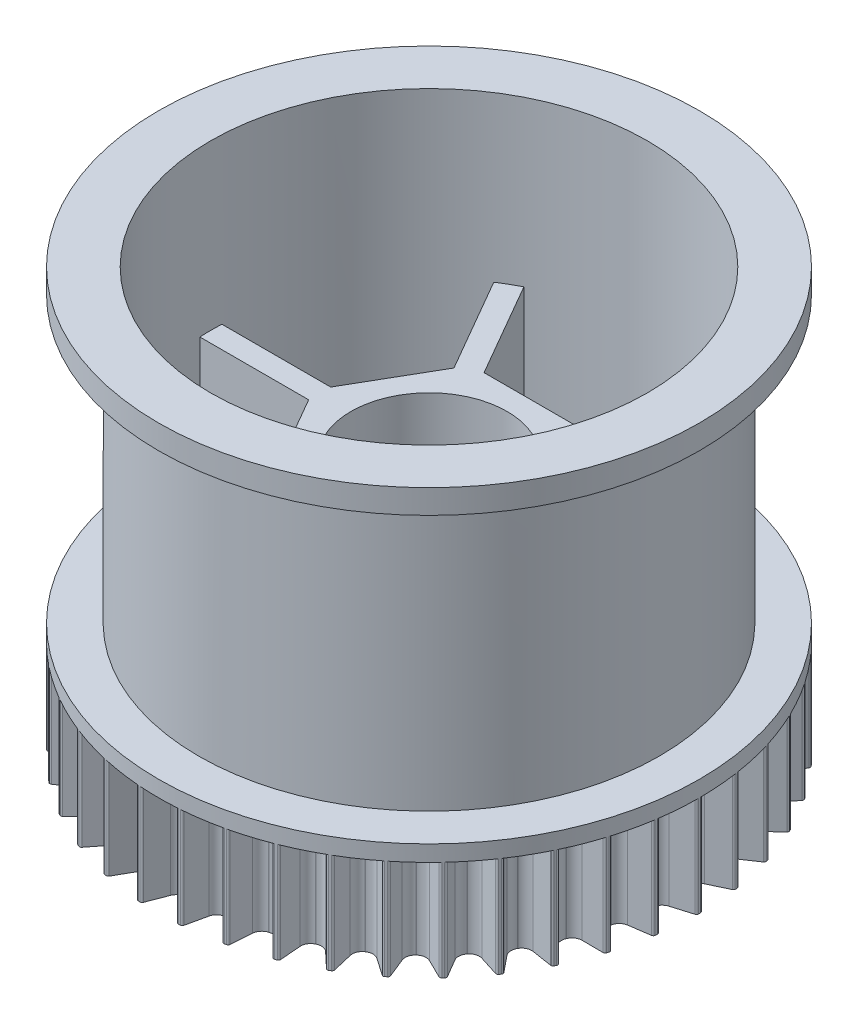
from build123d import *

# Parameters (mm, degrees)
SKETCH_1_R          = 3.9
EXTRUDE_1_DEPTH     = 5
SKETCH_2_R          = 13.5
SKETCH_2_R_2        = 11.2
EXTRUDE_2_DEPTH     = 0.8
SKETCH_2_2_R        = 11.5
SKETCH_2_2_R_2      = 10.9
EXTRUDE_2_2_DEPTH   = 15
SKETCH_5_R          = 13.5
SKETCH_5_R_2        = 10.9
EXTRUDE_3_DEPTH     = 1.2
SKETCH_6_R          = 3.9
EXTRUDE_5_DEPTH     = 8
SKETCH_8_R          = 3.9
SKETCH_8_R_2        = 3.4
EXTRUDE_6_DEPTH     = 13
SKETCH_8_2_R        = 3.9
SKETCH_8_2_R_2      = 3.4
CUT_EXTRUDE_1_DEPTH = 3
CUT_EXTRUDE_START   = -3
SKETCH_9_R          = 3.9
CUT_EXTRUDE_2_DEPTH = 3


with BuildPart() as part:
    # 草图1 → 凸台-拉伸1 (new body)
    with BuildSketch(Plane(origin=(0, 0, 0), x_dir=(1, 0, 0), z_dir=(0, 1, 0))):
        with BuildLine():
            Line((12.421648835, 0.449416948), (13.428727986, 0.146279171))
            ThreePointArc((13.428727986, 0.146279171), (13.480048996, 0.110330314), (13.499904043, 0.050900158))
            ThreePointArc((13.499904043, 0.050900158), (13.5, 0), (13.499904043, -0.050900158))
            ThreePointArc((13.499904043, -0.050900158), (13.480048996, -0.110330314), (13.428727986, -0.146279171))
            Line((13.428727986, -0.146279171), (12.421648835, -0.449416948))
            ThreePointArc((12.421648835, -0.449416948), (12.175747513, -0.615329239), (12.067123529, -0.89136398))
            ThreePointArc((12.067123529, -0.89136398), (12.066165946, -0.904234132), (12.065194637, -0.917103256))
            ThreePointArc((12.065194637, -0.917103256), (12.131464538, -1.206244482), (12.349891401, -1.40695336))
            Line((12.349891401, -1.40695336), (13.300541969, -1.856802698))
            ThreePointArc((13.300541969, -1.856802698), (13.345931866, -1.899999035), (13.356707544, -1.961724646))
            ThreePointArc((13.356707544, -1.961724646), (13.349216154, -2.012070593), (13.341534994, -2.062387937))
            ThreePointArc((13.341534994, -2.062387937), (13.313044106, -2.118195066), (13.256938411, -2.146093404))
            Line((13.256938411, -2.146093404), (12.21592716, -2.295748024))
            ThreePointArc((12.21592716, -2.295748024), (11.948044409, -2.423157522), (11.799492821, -2.679919618))
            ThreePointArc((11.799492821, -2.679919618), (11.796627737, -2.692503301), (11.793749233, -2.705083921))
            ThreePointArc((11.793749233, -2.705083921), (11.816184691, -3.000872694), (12.0022578, -3.231894655))
            Line((12.0022578, -3.231894655), (12.875243823, -3.818406662))
            ThreePointArc((12.875243823, -3.818406662), (12.913688672, -3.867885545), (12.915144269, -3.930527764))
            ThreePointArc((12.915144269, -3.930527764), (12.900232878, -3.979194855), (12.885138099, -4.027805378))
            ThreePointArc((12.885138099, -4.027805378), (12.84864781, -4.07874284), (12.789010738, -4.097967457))
            Line((12.789010738, -4.097967457), (11.737321858, -4.090795883))
            ThreePointArc((11.737321858, -4.090795883), (11.453441736, -4.176856469), (11.268280943, -4.40861028))
            ThreePointArc((11.268280943, -4.40861028), (11.263572359, -4.420626395), (11.258850961, -4.432637481))
            ThreePointArc((11.258850961, -4.432637481), (11.236950804, -4.72846637), (11.386513594, -4.984640763))
            Line((11.386513594, -4.984640763), (12.162334005, -5.694713732))
            ThreePointArc((12.162334005, -5.694713732), (12.192975012, -5.749369884), (12.185078013, -5.811529386))
            ThreePointArc((12.185078013, -5.811529386), (12.163079717, -5.857430478), (12.140908512, -5.903248302))
            ThreePointArc((12.140908512, -5.903248302), (12.097233954, -5.94817824), (12.035397698, -5.958299689))
            Line((12.035397698, -5.958299689), (10.996524182, -5.794462121))
            ThreePointArc((10.996524182, -5.794462121), (10.702988102, -5.837251346), (10.485354288, -6.038819873))
            ThreePointArc((10.485354288, -6.038819873), (10.478907386, -6.05), (10.472448563, -6.061173244))
            ThreePointArc((10.472448563, -6.061173244), (10.406702004, -6.35043392), (10.51641349, -6.626038234))
            Line((10.51641349, -6.626038234), (11.177737743, -7.443810306))
            ThreePointArc((11.177737743, -7.443810306), (11.199890439, -7.5024228), (11.18281725, -7.562711045))
            ThreePointArc((11.18281725, -7.562711045), (11.154223453, -7.604820784), (11.12547109, -7.646822414))
            ThreePointArc((11.12547109, -7.646822414), (11.075587881, -7.684741166), (11.012933761, -7.685533352))
            Line((11.012933761, -7.685533352), (10.010082327, -7.368689651))
            ThreePointArc((10.010082327, -7.368689651), (9.713447399, -7.367251672), (9.468202145, -7.534132209))
            ThreePointArc((9.468202145, -7.534132209), (9.460160938, -7.544226602), (9.452108969, -7.554312413))
            ThreePointArc((9.452108969, -7.554312413), (9.343984679, -7.83054327), (9.411394086, -8.11942096))
            Line((9.411394086, -8.11942096), (9.943449291, -9.026624459))
            ThreePointArc((9.943449291, -9.026624459), (9.956618821, -9.087883988), (9.930750828, -9.144954237))
            ThreePointArc((9.930750828, -9.144954237), (9.89620027, -9.18233196), (9.861509029, -9.219579149))
            ThreePointArc((9.861509029, -9.219579149), (9.806531477, -9.249639674), (9.744459083, -9.241084899))
            Line((9.744459083, -9.241084899), (8.800031773, -8.778312831))
            ThreePointArc((8.800031773, -8.778312831), (8.506924332, -8.732679771), (8.239546012, -8.861144482))
            ThreePointArc((8.239546012, -8.861144482), (8.230090127, -8.869927649), (8.22062488, -8.878700726))
            ThreePointArc((8.22062488, -8.878700726), (8.072538176, -9.135731223), (8.09613969, -9.431429239))
            Line((8.09613969, -9.431429239), (8.487040612, -10.407798738))
            ThreePointArc((8.487040612, -10.407798738), (8.49093279, -10.470336865), (8.456847843, -10.522914262))
            ThreePointArc((8.456847843, -10.522914262), (8.417112325, -10.554725013), (8.377257151, -10.586385721))
            ThreePointArc((8.377257151, -10.586385721), (8.318413365, -10.607916516), (8.258309291, -10.59020588))
            Line((8.258309291, -10.59020588), (7.393403052, -9.991843007))
            ThreePointArc((7.393403052, -9.991843007), (7.110370633, -9.903034234), (6.826832036, -9.990213429))
            ThreePointArc((6.826832036, -9.990213429), (6.816172703, -9.997489169), (6.805505615, -10.004753536))
            ThreePointArc((6.805505615, -10.004753536), (6.620764509, -10.236842037), (6.600030911, -10.532754974))
            Line((6.600030911, -10.532754974), (6.841045471, -11.556479991))
            ThreePointArc((6.841045471, -11.556479991), (6.835573353, -11.618899718), (6.794032851, -11.665809771))
            ThreePointArc((6.794032851, -11.665809771), (6.75, -11.691342951), (6.705871192, -11.716709929))
            ThreePointArc((6.705871192, -11.716709929), (6.644475643, -11.729230032), (6.587682515, -11.702759162))
            Line((6.587682515, -11.702759162), (5.821617923, -10.982171922))
            ThreePointArc((5.821617923, -10.982171922), (5.554983004, -10.852171276), (5.261617913, -10.896117516))
            ThreePointArc((5.261617913, -10.896117516), (5.249993243, -10.901723302), (5.238362601, -10.907316685))
            ThreePointArc((5.238362601, -10.907316685), (5.021093904, -11.109278715), (4.956488349, -11.398796367))
            Line((4.956488349, -11.398796367), (5.042232678, -12.447008578))
            ThreePointArc((5.042232678, -12.447008578), (5.027518502, -12.507915551), (4.979450393, -12.548110367))
            ThreePointArc((4.979450393, -12.548110367), (4.932103829, -12.566795607), (4.884687151, -12.585302199))
            ThreePointArc((4.884687151, -12.585302199), (4.822111316, -12.588531931), (4.769897799, -12.553892142))
            Line((4.769897799, -12.553892142), (4.11978747, -11.727177263))
            ThreePointArc((4.11978747, -11.727177263), (3.875506233, -11.558888745), (3.578867941, -11.558620344))
            ThreePointArc((3.578867941, -11.558620344), (3.56653761, -11.56243095), (3.554203222, -11.566228402))
            ThreePointArc((3.554203222, -11.566228402), (3.309260359, -11.733552465), (3.202226027, -12.010207485))
            Line((3.202226027, -12.010207485), (3.13078474, -13.059491561))
            ThreePointArc((3.13078474, -13.059491561), (3.107157195, -13.117525219), (3.053635241, -13.150106913))
            ThreePointArc((3.053635241, -13.150106913), (3.004032608, -13.161526814), (2.954387271, -13.172759614))
            ThreePointArc((2.954387271, -13.172759614), (2.89202899, -13.166626828), (2.845561447, -13.124591917))
            Line((2.845561447, -13.124591917), (2.325927773, -12.210216843))
            ThreePointArc((2.325927773, -12.210216843), (2.109457058, -12.007399739), (1.816171974, -11.962922693))
            ThreePointArc((1.816171974, -11.962922693), (1.803411421, -11.964852997), (1.790648816, -11.96676969))
            ThreePointArc((1.790648816, -11.96676969), (1.523503405, -12.095718042), (1.376431267, -12.353330415))
            Line((1.376431267, -12.353330415), (1.149400244, -13.380247083))
            ThreePointArc((1.149400244, -13.380247083), (1.117387131, -13.43411105), (1.059606923, -13.4583518))
            ThreePointArc((1.059606923, -13.4583518), (1.008856263, -13.462251262), (0.958091262, -13.465959347))
            ThreePointArc((0.958091262, -13.465959347), (0.897343515, -13.45060104), (0.857659955, -13.402109995))
            Line((0.857659955, -13.402109995), (0.480110693, -12.420500356))
            ThreePointArc((0.480110693, -12.420500356), (0.296286097, -12.187685265), (0.012905725, -12.099993117))
            ThreePointArc((0.012905725, -12.099993117), (0, -12.1), (-0.012905725, -12.099993117))
            ThreePointArc((-0.012905725, -12.099993117), (-0.296286097, -12.187685265), (-0.480110693, -12.420500356))
            Line((-0.480110693, -12.420500356), (-0.857659955, -13.402109995))
            ThreePointArc((-0.857659955, -13.402109995), (-0.897343515, -13.45060104), (-0.958091262, -13.465959347))
            ThreePointArc((-0.958091262, -13.465959347), (-1.008856263, -13.462251262), (-1.059606923, -13.4583518))
            ThreePointArc((-1.059606923, -13.4583518), (-1.117387131, -13.43411105), (-1.149400244, -13.380247083))
            Line((-1.149400244, -13.380247083), (-1.376431267, -12.353330415))
            ThreePointArc((-1.376431267, -12.353330415), (-1.523503405, -12.095718042), (-1.790648816, -11.96676969))
            ThreePointArc((-1.790648816, -11.96676969), (-1.803411421, -11.964852997), (-1.816171974, -11.962922693))
            ThreePointArc((-1.816171974, -11.962922693), (-2.109457058, -12.007399739), (-2.325927773, -12.210216843))
            Line((-2.325927773, -12.210216843), (-2.845561447, -13.124591917))
            ThreePointArc((-2.845561447, -13.124591917), (-2.89202899, -13.166626828), (-2.954387271, -13.172759614))
            ThreePointArc((-2.954387271, -13.172759614), (-3.004032608, -13.161526814), (-3.053635241, -13.150106913))
            ThreePointArc((-3.053635241, -13.150106913), (-3.107157195, -13.117525219), (-3.13078474, -13.059491561))
            Line((-3.13078474, -13.059491561), (-3.202226027, -12.010207485))
            ThreePointArc((-3.202226027, -12.010207485), (-3.309260359, -11.733552465), (-3.554203222, -11.566228402))
            ThreePointArc((-3.554203222, -11.566228402), (-3.56653761, -11.56243095), (-3.578867941, -11.558620344))
            ThreePointArc((-3.578867941, -11.558620344), (-3.875506233, -11.558888745), (-4.11978747, -11.727177263))
            Line((-4.11978747, -11.727177263), (-4.769897799, -12.553892142))
            ThreePointArc((-4.769897799, -12.553892142), (-4.822111316, -12.588531931), (-4.884687151, -12.585302199))
            ThreePointArc((-4.884687151, -12.585302199), (-4.932103829, -12.566795607), (-4.979450393, -12.548110367))
            ThreePointArc((-4.979450393, -12.548110367), (-5.027518502, -12.507915551), (-5.042232678, -12.447008578))
            Line((-5.042232678, -12.447008578), (-4.956488349, -11.398796367))
            ThreePointArc((-4.956488349, -11.398796367), (-5.021093904, -11.109278715), (-5.238362601, -10.907316685))
            ThreePointArc((-5.238362601, -10.907316685), (-5.249993243, -10.901723302), (-5.261617913, -10.896117516))
            ThreePointArc((-5.261617913, -10.896117516), (-5.554983004, -10.852171276), (-5.821617923, -10.982171922))
            Line((-5.821617923, -10.982171922), (-6.587682515, -11.702759162))
            ThreePointArc((-6.587682515, -11.702759162), (-6.644475643, -11.729230032), (-6.705871192, -11.716709929))
            ThreePointArc((-6.705871192, -11.716709929), (-6.75, -11.691342951), (-6.794032851, -11.665809771))
            ThreePointArc((-6.794032851, -11.665809771), (-6.835573353, -11.618899718), (-6.841045471, -11.556479991))
            Line((-6.841045471, -11.556479991), (-6.600030911, -10.532754974))
            ThreePointArc((-6.600030911, -10.532754974), (-6.620764509, -10.236842037), (-6.805505615, -10.004753536))
            ThreePointArc((-6.805505615, -10.004753536), (-6.816172703, -9.997489169), (-6.826832036, -9.990213429))
            ThreePointArc((-6.826832036, -9.990213429), (-7.110370633, -9.903034234), (-7.393403052, -9.991843007))
            Line((-7.393403052, -9.991843007), (-8.258309291, -10.59020588))
            ThreePointArc((-8.258309291, -10.59020588), (-8.318413365, -10.607916516), (-8.377257151, -10.586385721))
            ThreePointArc((-8.377257151, -10.586385721), (-8.417112325, -10.554725013), (-8.456847843, -10.522914262))
            ThreePointArc((-8.456847843, -10.522914262), (-8.49093279, -10.470336865), (-8.487040612, -10.407798738))
            Line((-8.487040612, -10.407798738), (-8.09613969, -9.431429239))
            ThreePointArc((-8.09613969, -9.431429239), (-8.072538176, -9.135731223), (-8.22062488, -8.878700726))
            ThreePointArc((-8.22062488, -8.878700726), (-8.230090127, -8.869927649), (-8.239546012, -8.861144482))
            ThreePointArc((-8.239546012, -8.861144482), (-8.506924332, -8.732679771), (-8.800031773, -8.778312831))
            Line((-8.800031773, -8.778312831), (-9.744459083, -9.241084899))
            ThreePointArc((-9.744459083, -9.241084899), (-9.806531477, -9.249639674), (-9.861509029, -9.219579149))
            ThreePointArc((-9.861509029, -9.219579149), (-9.89620027, -9.18233196), (-9.930750828, -9.144954237))
            ThreePointArc((-9.930750828, -9.144954237), (-9.956618821, -9.087883988), (-9.943449291, -9.026624459))
            Line((-9.943449291, -9.026624459), (-9.411394086, -8.11942096))
            ThreePointArc((-9.411394086, -8.11942096), (-9.343984679, -7.83054327), (-9.452108969, -7.554312413))
            ThreePointArc((-9.452108969, -7.554312413), (-9.460160938, -7.544226602), (-9.468202145, -7.534132209))
            ThreePointArc((-9.468202145, -7.534132209), (-9.713447399, -7.367251672), (-10.010082327, -7.368689651))
            Line((-10.010082327, -7.368689651), (-11.012933761, -7.685533352))
            ThreePointArc((-11.012933761, -7.685533352), (-11.075587881, -7.684741166), (-11.12547109, -7.646822414))
            ThreePointArc((-11.12547109, -7.646822414), (-11.154223453, -7.604820784), (-11.18281725, -7.562711045))
            ThreePointArc((-11.18281725, -7.562711045), (-11.199890439, -7.5024228), (-11.177737743, -7.443810306))
            Line((-11.177737743, -7.443810306), (-10.51641349, -6.626038234))
            ThreePointArc((-10.51641349, -6.626038234), (-10.406702004, -6.35043392), (-10.472448563, -6.061173244))
            ThreePointArc((-10.472448563, -6.061173244), (-10.478907386, -6.05), (-10.485354288, -6.038819873))
            ThreePointArc((-10.485354288, -6.038819873), (-10.702988102, -5.837251346), (-10.996524182, -5.794462121))
            Line((-10.996524182, -5.794462121), (-12.035397698, -5.958299689))
            ThreePointArc((-12.035397698, -5.958299689), (-12.097233954, -5.94817824), (-12.140908512, -5.903248302))
            ThreePointArc((-12.140908512, -5.903248302), (-12.163079717, -5.857430478), (-12.185078013, -5.811529386))
            ThreePointArc((-12.185078013, -5.811529386), (-12.192975012, -5.749369884), (-12.162334005, -5.694713732))
            Line((-12.162334005, -5.694713732), (-11.386513594, -4.984640763))
            ThreePointArc((-11.386513594, -4.984640763), (-11.236950804, -4.72846637), (-11.258850961, -4.432637481))
            ThreePointArc((-11.258850961, -4.432637481), (-11.263572359, -4.420626395), (-11.268280943, -4.40861028))
            ThreePointArc((-11.268280943, -4.40861028), (-11.453441736, -4.176856469), (-11.737321858, -4.090795883))
            Line((-11.737321858, -4.090795883), (-12.789010738, -4.097967457))
            ThreePointArc((-12.789010738, -4.097967457), (-12.84864781, -4.07874284), (-12.885138099, -4.027805378))
            ThreePointArc((-12.885138099, -4.027805378), (-12.900232878, -3.979194855), (-12.915144269, -3.930527764))
            ThreePointArc((-12.915144269, -3.930527764), (-12.913688672, -3.867885545), (-12.875243823, -3.818406662))
            Line((-12.875243823, -3.818406662), (-12.0022578, -3.231894655))
            ThreePointArc((-12.0022578, -3.231894655), (-11.816184691, -3.000872694), (-11.793749233, -2.705083921))
            ThreePointArc((-11.793749233, -2.705083921), (-11.796627737, -2.692503301), (-11.799492821, -2.679919618))
            ThreePointArc((-11.799492821, -2.679919618), (-11.948044409, -2.423157522), (-12.21592716, -2.295748024))
            Line((-12.21592716, -2.295748024), (-13.256938411, -2.146093404))
            ThreePointArc((-13.256938411, -2.146093404), (-13.313044106, -2.118195066), (-13.341534994, -2.062387937))
            ThreePointArc((-13.341534994, -2.062387937), (-13.349216154, -2.012070593), (-13.356707544, -1.961724646))
            ThreePointArc((-13.356707544, -1.961724646), (-13.345931866, -1.899999035), (-13.300541969, -1.856802698))
            Line((-13.300541969, -1.856802698), (-12.349891401, -1.40695336))
            ThreePointArc((-12.349891401, -1.40695336), (-12.131464538, -1.206244482), (-12.065194637, -0.917103256))
            ThreePointArc((-12.065194637, -0.917103256), (-12.066165946, -0.904234132), (-12.067123529, -0.89136398))
            ThreePointArc((-12.067123529, -0.89136398), (-12.175747513, -0.615329239), (-12.421648835, -0.449416948))
            Line((-12.421648835, -0.449416948), (-13.428727986, -0.146279171))
            ThreePointArc((-13.428727986, -0.146279171), (-13.480048996, -0.110330314), (-13.499904043, -0.050900158))
            ThreePointArc((-13.499904043, -0.050900158), (-13.5, 0), (-13.499904043, 0.050900158))
            ThreePointArc((-13.499904043, 0.050900158), (-13.480048996, 0.110330314), (-13.428727986, 0.146279171))
            Line((-13.428727986, 0.146279171), (-12.421648835, 0.449416948))
            ThreePointArc((-12.421648835, 0.449416948), (-12.175747513, 0.615329239), (-12.067123529, 0.89136398))
            ThreePointArc((-12.067123529, 0.89136398), (-12.066165946, 0.904234132), (-12.065194637, 0.917103256))
            ThreePointArc((-12.065194637, 0.917103256), (-12.131464538, 1.206244482), (-12.349891401, 1.40695336))
            Line((-12.349891401, 1.40695336), (-13.300541969, 1.856802698))
            ThreePointArc((-13.300541969, 1.856802698), (-13.345931866, 1.899999035), (-13.356707544, 1.961724646))
            ThreePointArc((-13.356707544, 1.961724646), (-13.349216154, 2.012070593), (-13.341534994, 2.062387937))
            ThreePointArc((-13.341534994, 2.062387937), (-13.313044106, 2.118195066), (-13.256938411, 2.146093404))
            Line((-13.256938411, 2.146093404), (-12.21592716, 2.295748024))
            ThreePointArc((-12.21592716, 2.295748024), (-11.948044409, 2.423157522), (-11.799492821, 2.679919618))
            ThreePointArc((-11.799492821, 2.679919618), (-11.796627737, 2.692503301), (-11.793749233, 2.705083921))
            ThreePointArc((-11.793749233, 2.705083921), (-11.816184691, 3.000872694), (-12.0022578, 3.231894655))
            Line((-12.0022578, 3.231894655), (-12.875243823, 3.818406662))
            ThreePointArc((-12.875243823, 3.818406662), (-12.913688672, 3.867885545), (-12.915144269, 3.930527764))
            ThreePointArc((-12.915144269, 3.930527764), (-12.900232878, 3.979194855), (-12.885138099, 4.027805378))
            ThreePointArc((-12.885138099, 4.027805378), (-12.84864781, 4.07874284), (-12.789010738, 4.097967457))
            Line((-12.789010738, 4.097967457), (-11.737321858, 4.090795883))
            ThreePointArc((-11.737321858, 4.090795883), (-11.453441736, 4.176856469), (-11.268280943, 4.40861028))
            ThreePointArc((-11.268280943, 4.40861028), (-11.263572359, 4.420626395), (-11.258850961, 4.432637481))
            ThreePointArc((-11.258850961, 4.432637481), (-11.236950804, 4.72846637), (-11.386513594, 4.984640763))
            Line((-11.386513594, 4.984640763), (-12.162334005, 5.694713732))
            ThreePointArc((-12.162334005, 5.694713732), (-12.192975012, 5.749369884), (-12.185078013, 5.811529386))
            ThreePointArc((-12.185078013, 5.811529386), (-12.163079717, 5.857430478), (-12.140908512, 5.903248302))
            ThreePointArc((-12.140908512, 5.903248302), (-12.097233954, 5.94817824), (-12.035397698, 5.958299689))
            Line((-12.035397698, 5.958299689), (-10.996524182, 5.794462121))
            ThreePointArc((-10.996524182, 5.794462121), (-10.702988102, 5.837251346), (-10.485354288, 6.038819873))
            ThreePointArc((-10.485354288, 6.038819873), (-10.478907386, 6.05), (-10.472448563, 6.061173244))
            ThreePointArc((-10.472448563, 6.061173244), (-10.406702004, 6.35043392), (-10.51641349, 6.626038234))
            Line((-10.51641349, 6.626038234), (-11.177737743, 7.443810306))
            ThreePointArc((-11.177737743, 7.443810306), (-11.199890439, 7.5024228), (-11.18281725, 7.562711045))
            ThreePointArc((-11.18281725, 7.562711045), (-11.154223453, 7.604820784), (-11.12547109, 7.646822414))
            ThreePointArc((-11.12547109, 7.646822414), (-11.075587881, 7.684741166), (-11.012933761, 7.685533352))
            Line((-11.012933761, 7.685533352), (-10.010082327, 7.368689651))
            ThreePointArc((-10.010082327, 7.368689651), (-9.713447399, 7.367251672), (-9.468202145, 7.534132209))
            ThreePointArc((-9.468202145, 7.534132209), (-9.460160938, 7.544226602), (-9.452108969, 7.554312413))
            ThreePointArc((-9.452108969, 7.554312413), (-9.343984679, 7.83054327), (-9.411394086, 8.11942096))
            Line((-9.411394086, 8.11942096), (-9.943449291, 9.026624459))
            ThreePointArc((-9.943449291, 9.026624459), (-9.956618821, 9.087883988), (-9.930750828, 9.144954237))
            ThreePointArc((-9.930750828, 9.144954237), (-9.89620027, 9.18233196), (-9.861509029, 9.219579149))
            ThreePointArc((-9.861509029, 9.219579149), (-9.806531477, 9.249639674), (-9.744459083, 9.241084899))
            Line((-9.744459083, 9.241084899), (-8.800031773, 8.778312831))
            ThreePointArc((-8.800031773, 8.778312831), (-8.506924332, 8.732679771), (-8.239546012, 8.861144482))
            ThreePointArc((-8.239546012, 8.861144482), (-8.230090127, 8.869927649), (-8.22062488, 8.878700726))
            ThreePointArc((-8.22062488, 8.878700726), (-8.072538176, 9.135731223), (-8.09613969, 9.431429239))
            Line((-8.09613969, 9.431429239), (-8.487040612, 10.407798738))
            ThreePointArc((-8.487040612, 10.407798738), (-8.49093279, 10.470336865), (-8.456847843, 10.522914262))
            ThreePointArc((-8.456847843, 10.522914262), (-8.417112325, 10.554725013), (-8.377257151, 10.586385721))
            ThreePointArc((-8.377257151, 10.586385721), (-8.318413365, 10.607916516), (-8.258309291, 10.59020588))
            Line((-8.258309291, 10.59020588), (-7.393403052, 9.991843007))
            ThreePointArc((-7.393403052, 9.991843007), (-7.110370633, 9.903034234), (-6.826832036, 9.990213429))
            ThreePointArc((-6.826832036, 9.990213429), (-6.816172703, 9.997489169), (-6.805505615, 10.004753536))
            ThreePointArc((-6.805505615, 10.004753536), (-6.620764509, 10.236842037), (-6.600030911, 10.532754974))
            Line((-6.600030911, 10.532754974), (-6.841045471, 11.556479991))
            ThreePointArc((-6.841045471, 11.556479991), (-6.835573353, 11.618899718), (-6.794032851, 11.665809771))
            ThreePointArc((-6.794032851, 11.665809771), (-6.75, 11.691342951), (-6.705871192, 11.716709929))
            ThreePointArc((-6.705871192, 11.716709929), (-6.644475643, 11.729230032), (-6.587682515, 11.702759162))
            Line((-6.587682515, 11.702759162), (-5.821617923, 10.982171922))
            ThreePointArc((-5.821617923, 10.982171922), (-5.554983004, 10.852171276), (-5.261617913, 10.896117516))
            ThreePointArc((-5.261617913, 10.896117516), (-5.249993243, 10.901723302), (-5.238362601, 10.907316685))
            ThreePointArc((-5.238362601, 10.907316685), (-5.021093904, 11.109278715), (-4.956488349, 11.398796367))
            Line((-4.956488349, 11.398796367), (-5.042232678, 12.447008578))
            ThreePointArc((-5.042232678, 12.447008578), (-5.027518502, 12.507915551), (-4.979450393, 12.548110367))
            ThreePointArc((-4.979450393, 12.548110367), (-4.932103829, 12.566795607), (-4.884687151, 12.585302199))
            ThreePointArc((-4.884687151, 12.585302199), (-4.822111316, 12.588531931), (-4.769897799, 12.553892142))
            Line((-4.769897799, 12.553892142), (-4.11978747, 11.727177263))
            ThreePointArc((-4.11978747, 11.727177263), (-3.875506233, 11.558888745), (-3.578867941, 11.558620344))
            ThreePointArc((-3.578867941, 11.558620344), (-3.56653761, 11.56243095), (-3.554203222, 11.566228402))
            ThreePointArc((-3.554203222, 11.566228402), (-3.309260359, 11.733552465), (-3.202226027, 12.010207485))
            Line((-3.202226027, 12.010207485), (-3.13078474, 13.059491561))
            ThreePointArc((-3.13078474, 13.059491561), (-3.107157195, 13.117525219), (-3.053635241, 13.150106913))
            ThreePointArc((-3.053635241, 13.150106913), (-3.004032608, 13.161526814), (-2.954387271, 13.172759614))
            ThreePointArc((-2.954387271, 13.172759614), (-2.89202899, 13.166626828), (-2.845561447, 13.124591917))
            Line((-2.845561447, 13.124591917), (-2.325927773, 12.210216843))
            ThreePointArc((-2.325927773, 12.210216843), (-2.109457058, 12.007399739), (-1.816171974, 11.962922693))
            ThreePointArc((-1.816171974, 11.962922693), (-1.803411421, 11.964852997), (-1.790648816, 11.96676969))
            ThreePointArc((-1.790648816, 11.96676969), (-1.523503405, 12.095718042), (-1.376431267, 12.353330415))
            Line((-1.376431267, 12.353330415), (-1.149400244, 13.380247083))
            ThreePointArc((-1.149400244, 13.380247083), (-1.117387131, 13.43411105), (-1.059606923, 13.4583518))
            ThreePointArc((-1.059606923, 13.4583518), (-1.008856263, 13.462251262), (-0.958091262, 13.465959347))
            ThreePointArc((-0.958091262, 13.465959347), (-0.897343515, 13.45060104), (-0.857659955, 13.402109995))
            Line((-0.857659955, 13.402109995), (-0.480110693, 12.420500356))
            ThreePointArc((-0.480110693, 12.420500356), (-0.296286097, 12.187685265), (-0.012905725, 12.099993117))
            ThreePointArc((-0.012905725, 12.099993117), (0, 12.1), (0.012905725, 12.099993117))
            ThreePointArc((0.012905725, 12.099993117), (0.296286097, 12.187685265), (0.480110693, 12.420500356))
            Line((0.480110693, 12.420500356), (0.857659955, 13.402109995))
            ThreePointArc((0.857659955, 13.402109995), (0.897343515, 13.45060104), (0.958091262, 13.465959347))
            ThreePointArc((0.958091262, 13.465959347), (1.008856263, 13.462251262), (1.059606923, 13.4583518))
            ThreePointArc((1.059606923, 13.4583518), (1.117387131, 13.43411105), (1.149400244, 13.380247083))
            Line((1.149400244, 13.380247083), (1.376431267, 12.353330415))
            ThreePointArc((1.376431267, 12.353330415), (1.523503405, 12.095718042), (1.790648816, 11.96676969))
            ThreePointArc((1.790648816, 11.96676969), (1.803411421, 11.964852997), (1.816171974, 11.962922693))
            ThreePointArc((1.816171974, 11.962922693), (2.109457058, 12.007399739), (2.325927773, 12.210216843))
            Line((2.325927773, 12.210216843), (2.845561447, 13.124591917))
            ThreePointArc((2.845561447, 13.124591917), (2.89202899, 13.166626828), (2.954387271, 13.172759614))
            ThreePointArc((2.954387271, 13.172759614), (3.004032608, 13.161526814), (3.053635241, 13.150106913))
            ThreePointArc((3.053635241, 13.150106913), (3.107157195, 13.117525219), (3.13078474, 13.059491561))
            Line((3.13078474, 13.059491561), (3.202226027, 12.010207485))
            ThreePointArc((3.202226027, 12.010207485), (3.309260359, 11.733552465), (3.554203222, 11.566228402))
            ThreePointArc((3.554203222, 11.566228402), (3.56653761, 11.56243095), (3.578867941, 11.558620344))
            ThreePointArc((3.578867941, 11.558620344), (3.875506233, 11.558888745), (4.11978747, 11.727177263))
            Line((4.11978747, 11.727177263), (4.769897799, 12.553892142))
            ThreePointArc((4.769897799, 12.553892142), (4.822111316, 12.588531931), (4.884687151, 12.585302199))
            ThreePointArc((4.884687151, 12.585302199), (4.932103829, 12.566795607), (4.979450393, 12.548110367))
            ThreePointArc((4.979450393, 12.548110367), (5.027518502, 12.507915551), (5.042232678, 12.447008578))
            Line((5.042232678, 12.447008578), (4.956488349, 11.398796367))
            ThreePointArc((4.956488349, 11.398796367), (5.021093904, 11.109278715), (5.238362601, 10.907316685))
            ThreePointArc((5.238362601, 10.907316685), (5.249993243, 10.901723302), (5.261617913, 10.896117516))
            ThreePointArc((5.261617913, 10.896117516), (5.554983004, 10.852171276), (5.821617923, 10.982171922))
            Line((5.821617923, 10.982171922), (6.587682515, 11.702759162))
            ThreePointArc((6.587682515, 11.702759162), (6.644475643, 11.729230032), (6.705871192, 11.716709929))
            ThreePointArc((6.705871192, 11.716709929), (6.75, 11.691342951), (6.794032851, 11.665809771))
            ThreePointArc((6.794032851, 11.665809771), (6.835573353, 11.618899718), (6.841045471, 11.556479991))
            Line((6.841045471, 11.556479991), (6.600030911, 10.532754974))
            ThreePointArc((6.600030911, 10.532754974), (6.620764509, 10.236842037), (6.805505615, 10.004753536))
            ThreePointArc((6.805505615, 10.004753536), (6.816172703, 9.997489169), (6.826832036, 9.990213429))
            ThreePointArc((6.826832036, 9.990213429), (7.110370633, 9.903034234), (7.393403052, 9.991843007))
            Line((7.393403052, 9.991843007), (8.258309291, 10.59020588))
            ThreePointArc((8.258309291, 10.59020588), (8.318413365, 10.607916516), (8.377257151, 10.586385721))
            ThreePointArc((8.377257151, 10.586385721), (8.417112325, 10.554725013), (8.456847843, 10.522914262))
            ThreePointArc((8.456847843, 10.522914262), (8.49093279, 10.470336865), (8.487040612, 10.407798738))
            Line((8.487040612, 10.407798738), (8.09613969, 9.431429239))
            ThreePointArc((8.09613969, 9.431429239), (8.072538176, 9.135731223), (8.22062488, 8.878700726))
            ThreePointArc((8.22062488, 8.878700726), (8.230090127, 8.869927649), (8.239546012, 8.861144482))
            ThreePointArc((8.239546012, 8.861144482), (8.506924332, 8.732679771), (8.800031773, 8.778312831))
            Line((8.800031773, 8.778312831), (9.744459083, 9.241084899))
            ThreePointArc((9.744459083, 9.241084899), (9.806531477, 9.249639674), (9.861509029, 9.219579149))
            ThreePointArc((9.861509029, 9.219579149), (9.89620027, 9.18233196), (9.930750828, 9.144954237))
            ThreePointArc((9.930750828, 9.144954237), (9.956618821, 9.087883988), (9.943449291, 9.026624459))
            Line((9.943449291, 9.026624459), (9.411394086, 8.11942096))
            ThreePointArc((9.411394086, 8.11942096), (9.343984679, 7.83054327), (9.452108969, 7.554312413))
            ThreePointArc((9.452108969, 7.554312413), (9.460160938, 7.544226602), (9.468202145, 7.534132209))
            ThreePointArc((9.468202145, 7.534132209), (9.713447399, 7.367251672), (10.010082327, 7.368689651))
            Line((10.010082327, 7.368689651), (11.012933761, 7.685533352))
            ThreePointArc((11.012933761, 7.685533352), (11.075587881, 7.684741166), (11.12547109, 7.646822414))
            ThreePointArc((11.12547109, 7.646822414), (11.154223453, 7.604820784), (11.18281725, 7.562711045))
            ThreePointArc((11.18281725, 7.562711045), (11.199890439, 7.5024228), (11.177737743, 7.443810306))
            Line((11.177737743, 7.443810306), (10.51641349, 6.626038234))
            ThreePointArc((10.51641349, 6.626038234), (10.406702004, 6.35043392), (10.472448563, 6.061173244))
            ThreePointArc((10.472448563, 6.061173244), (10.478907386, 6.05), (10.485354288, 6.038819873))
            ThreePointArc((10.485354288, 6.038819873), (10.702988102, 5.837251346), (10.996524182, 5.794462121))
            Line((10.996524182, 5.794462121), (12.035397698, 5.958299689))
            ThreePointArc((12.035397698, 5.958299689), (12.097233954, 5.94817824), (12.140908512, 5.903248302))
            ThreePointArc((12.140908512, 5.903248302), (12.163079717, 5.857430478), (12.185078013, 5.811529386))
            ThreePointArc((12.185078013, 5.811529386), (12.192975012, 5.749369884), (12.162334005, 5.694713732))
            Line((12.162334005, 5.694713732), (11.386513594, 4.984640763))
            ThreePointArc((11.386513594, 4.984640763), (11.236950804, 4.72846637), (11.258850961, 4.432637481))
            ThreePointArc((11.258850961, 4.432637481), (11.263572359, 4.420626395), (11.268280943, 4.40861028))
            ThreePointArc((11.268280943, 4.40861028), (11.453441736, 4.176856469), (11.737321858, 4.090795883))
            Line((11.737321858, 4.090795883), (12.789010738, 4.097967457))
            ThreePointArc((12.789010738, 4.097967457), (12.84864781, 4.07874284), (12.885138099, 4.027805378))
            ThreePointArc((12.885138099, 4.027805378), (12.900232878, 3.979194855), (12.915144269, 3.930527764))
            ThreePointArc((12.915144269, 3.930527764), (12.913688672, 3.867885545), (12.875243823, 3.818406662))
            Line((12.875243823, 3.818406662), (12.0022578, 3.231894655))
            ThreePointArc((12.0022578, 3.231894655), (11.816184691, 3.000872694), (11.793749233, 2.705083921))
            ThreePointArc((11.793749233, 2.705083921), (11.796627737, 2.692503301), (11.799492821, 2.679919618))
            ThreePointArc((11.799492821, 2.679919618), (11.948044409, 2.423157522), (12.21592716, 2.295748024))
            Line((12.21592716, 2.295748024), (13.256938411, 2.146093404))
            ThreePointArc((13.256938411, 2.146093404), (13.313044106, 2.118195066), (13.341534994, 2.062387937))
            ThreePointArc((13.341534994, 2.062387937), (13.349216154, 2.012070593), (13.356707544, 1.961724646))
            ThreePointArc((13.356707544, 1.961724646), (13.345931866, 1.899999035), (13.300541969, 1.856802698))
            Line((13.300541969, 1.856802698), (12.349891401, 1.40695336))
            ThreePointArc((12.349891401, 1.40695336), (12.131464538, 1.206244482), (12.065194637, 0.917103256))
            ThreePointArc((12.065194637, 0.917103256), (12.066165946, 0.904234132), (12.067123529, 0.89136398))
            ThreePointArc((12.067123529, 0.89136398), (12.175747513, 0.615329239), (12.421648835, 0.449416948))
        make_face()
        with Locations(Location((0, 0, 0), (0, 0, 270))):
            Circle(SKETCH_1_R, mode=Mode.SUBTRACT)
        with BuildLine():
            Line((3.204293994, -4.45), (5.455960044, -0.55))
            Line((5.455960044, -0.55), (11.186487384, -0.55))
            ThreePointArc((11.186487384, -0.55), (9.699484522, -5.6), (6.069557664, -9.412782254))
            Line((6.069557664, -9.412782254), (3.204293994, -4.45))
        make_face(mode=Mode.SUBTRACT)
        with BuildLine():
            Line((2.25166605, -5), (-2.25166605, -5))
            Line((-2.25166605, -5), (-5.11692972, -9.962782254))
            ThreePointArc((-5.11692972, -9.962782254), (0, -11.2), (5.11692972, -9.962782254))
            Line((5.11692972, -9.962782254), (2.25166605, -5))
        make_face(mode=Mode.SUBTRACT)
        with BuildLine():
            Line((-3.204293994, -4.45), (-5.455960044, -0.55))
            Line((-5.455960044, -0.55), (-11.186487384, -0.55))
            ThreePointArc((-11.186487384, -0.55), (-9.699484522, -5.6), (-6.069557664, -9.412782254))
            Line((-6.069557664, -9.412782254), (-3.204293994, -4.45))
        make_face(mode=Mode.SUBTRACT)
        with BuildLine():
            Line((5.455960044, 0.55), (11.186487384, 0.55))
            ThreePointArc((11.186487384, 0.55), (9.699484522, 5.6), (6.069557664, 9.412782254))
            Line((6.069557664, 9.412782254), (3.204293994, 4.45))
            Line((3.204293994, 4.45), (5.455960044, 0.55))
        make_face(mode=Mode.SUBTRACT)
        with BuildLine():
            Line((-5.455960044, 0.55), (-11.186487384, 0.55))
            ThreePointArc((-11.186487384, 0.55), (-9.699484522, 5.6), (-6.069557664, 9.412782254))
            Line((-6.069557664, 9.412782254), (-3.204293994, 4.45))
            Line((-3.204293994, 4.45), (-5.455960044, 0.55))
        make_face(mode=Mode.SUBTRACT)
        with BuildLine():
            Line((-2.25166605, 5), (-5.11692972, 9.962782254))
            ThreePointArc((-5.11692972, 9.962782254), (0, 11.2), (5.11692972, 9.962782254))
            Line((5.11692972, 9.962782254), (2.25166605, 5))
            Line((2.25166605, 5), (-2.25166605, 5))
        make_face(mode=Mode.SUBTRACT)
    extrude(amount=EXTRUDE_1_DEPTH)

    # 草图2 → Extrude 2 (add)
    with BuildSketch(Plane(origin=(0, 5, 0), x_dir=(1, 0, 0), z_dir=(0, 1, 0))):
        with Locations(Location((0, 0, 0), (0, 0, 94.069686794))):
            Circle(SKETCH_2_R)
        with Locations(Location((0, 0, 0), (0, 0, 117.18523589))):
            Circle(SKETCH_2_R_2, mode=Mode.SUBTRACT)
    extrude(amount=EXTRUDE_2_DEPTH)

    # 草图2<2> → Extrude 2 2 (add)
    with BuildSketch(Plane(origin=(0, 5, 0), x_dir=(1, 0, 0), z_dir=(0, 1, 0))):
        Circle(SKETCH_2_2_R)
        Circle(SKETCH_2_2_R_2, mode=Mode.SUBTRACT)
    extrude(amount=EXTRUDE_2_2_DEPTH)

    # 草图5 → 凸台-拉伸3 (add)
    with BuildSketch(Plane(origin=(0, 20, 0), x_dir=(1, 0, 0), z_dir=(0, 1, 0))):
        with Locations(Location((0, 0, 0), (0, 0, 94.069686794))):
            Circle(SKETCH_5_R)
        with Locations(Location((0, 0, 0), (0, 0, 117.107700331))):
            Circle(SKETCH_5_R_2, mode=Mode.SUBTRACT)
    extrude(amount=EXTRUDE_3_DEPTH)

    # 草图6 → 凸台-拉伸5 (add)
    with BuildSketch(Plane(origin=(0, 5, 0), x_dir=(1, 0, 0), z_dir=(0, 1, 0))):
        with BuildLine():
            Line((-4.966743533, -9.702652147), (-2.25166605, -5))
            Line((-2.25166605, -5), (2.25166605, -5))
            Line((2.25166605, -5), (4.966743533, -9.702652147))
            ThreePointArc((4.966743533, -9.702652147), (5.45, -9.439676901), (5.919371477, -9.152652147))
            Line((5.919371477, -9.152652147), (3.204293994, -4.45))
            Line((3.204293994, -4.45), (5.455960044, -0.55))
            Line((5.455960044, -0.55), (10.886115009, -0.55))
            ThreePointArc((10.886115009, -0.55), (10.9, 0), (10.886115009, 0.55))
            Line((10.886115009, 0.55), (5.455960044, 0.55))
            Line((5.455960044, 0.55), (3.204293994, 4.45))
            Line((3.204293994, 4.45), (5.919371477, 9.152652147))
            ThreePointArc((5.919371477, 9.152652147), (5.45, 9.439676901), (4.966743533, 9.702652147))
            Line((4.966743533, 9.702652147), (2.25166605, 5))
            Line((2.25166605, 5), (-2.25166605, 5))
            Line((-2.25166605, 5), (-4.966743533, 9.702652147))
            ThreePointArc((-4.966743533, 9.702652147), (-5.45, 9.439676901), (-5.919371477, 9.152652147))
            Line((-5.919371477, 9.152652147), (-3.204293994, 4.45))
            Line((-3.204293994, 4.45), (-5.455960044, 0.55))
            Line((-5.455960044, 0.55), (-10.886115009, 0.55))
            ThreePointArc((-10.886115009, 0.55), (-10.9, 0), (-10.886115009, -0.55))
            Line((-10.886115009, -0.55), (-5.455960044, -0.55))
            Line((-5.455960044, -0.55), (-3.204293994, -4.45))
            Line((-3.204293994, -4.45), (-5.919371477, -9.152652147))
            ThreePointArc((-5.919371477, -9.152652147), (-5.45, -9.439676901), (-4.966743533, -9.702652147))
        make_face()
        with Locations(Location((0, 0, 0), (0, 0, 270))):
            Circle(SKETCH_6_R, mode=Mode.SUBTRACT)
    extrude(amount=EXTRUDE_5_DEPTH)

    # 草图8 → 凸台-拉伸6 (add)
    with BuildSketch(Plane.XZ):
        Circle(SKETCH_8_R)
        with Locations(Location((0, 0, 0), (0, 0, 270))):
            Circle(SKETCH_8_R_2, mode=Mode.SUBTRACT)
    extrude(amount=-EXTRUDE_6_DEPTH)

    # 草图8<2> → 切除-拉伸1 (cut)
    with BuildSketch(Plane.XZ):
        with Locations(Location((0, 0, 0), (0, 0, 270))):
            Circle(SKETCH_8_2_R)
        with Locations(Location((0, 0, 0), (0, 0, 270))):
            Circle(SKETCH_8_2_R_2, mode=Mode.SUBTRACT)
    extrude(amount=-CUT_EXTRUDE_1_DEPTH, mode=Mode.SUBTRACT)

    # 草图9 → 切除-拉伸2 (cut)
    with BuildSketch(Plane(origin=(0, 13, 0), x_dir=(1, 0, 0), z_dir=(0, 1, 0)).offset(CUT_EXTRUDE_START)):
        with Locations(Location((0, 0, 0), (0, 0, 90))):
            Circle(SKETCH_9_R)
    extrude(amount=CUT_EXTRUDE_2_DEPTH, mode=Mode.SUBTRACT)


solid = part.part
